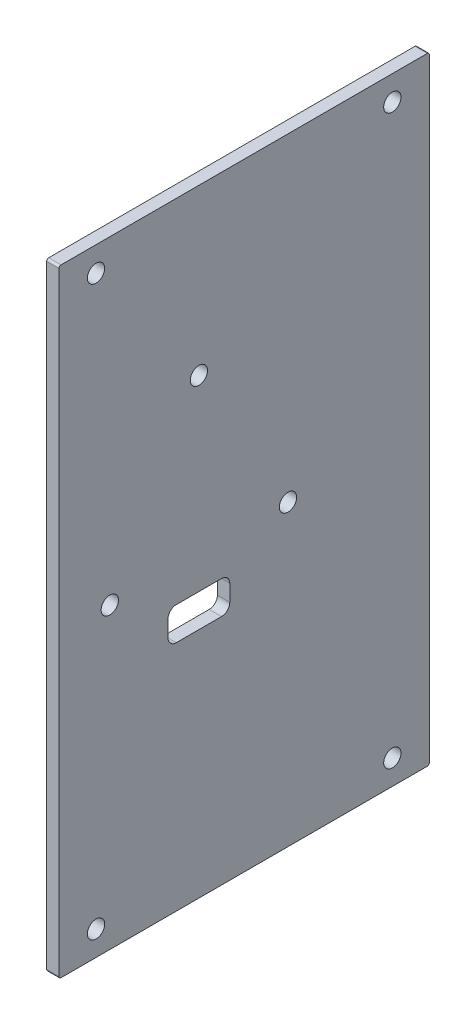
from build123d import *

# Parameters (mm, degrees)
SKETCH1_W           = 90
SKETCH1_H           = 150
SKETCH1_R           = 2.1
BOSS_EXTRUDE1_DEPTH = 3
FILLET1_R           = 0.5


with BuildPart() as part:
    # Sketch1 → Boss-Extrude1 (new body)
    with BuildSketch(Plane(origin=(0, 0, 0), x_dir=(0, 0, -1), z_dir=(1, 0, 0))):
        with Locations((45, -75)):
            Rectangle(SKETCH1_W, SKETCH1_H)
        with Locations((34, -40)):
            Circle(SKETCH1_R, mode=Mode.SUBTRACT)
        with Locations((55.650635095, -77.5)):
            Circle(SKETCH1_R, mode=Mode.SUBTRACT)
        with Locations((12.349364905, -77.5)):
            Circle(SKETCH1_R, mode=Mode.SUBTRACT)
        with Locations((9, -6)):
            Circle(SKETCH1_R, mode=Mode.SUBTRACT)
        with Locations((81, -6)):
            Circle(SKETCH1_R, mode=Mode.SUBTRACT)
        with Locations((81, -144)):
            Circle(SKETCH1_R, mode=Mode.SUBTRACT)
        with Locations((9, -144)):
            Circle(SKETCH1_R, mode=Mode.SUBTRACT)
        with BuildLine():
            Line((34, -85.5), (28.5, -85.5))
            ThreePointArc((28.5, -85.5), (27.085786438, -86.085786438), (26.5, -87.5))
            Line((26.5, -87.5), (26.5, -91.5))
            ThreePointArc((26.5, -91.5), (27.085786438, -92.914213562), (28.5, -93.5))
            Line((28.5, -93.5), (39.5, -93.5))
            ThreePointArc((39.5, -93.5), (40.914213562, -92.914213562), (41.5, -91.5))
            Line((41.5, -91.5), (41.5, -87.5))
            ThreePointArc((41.5, -87.5), (40.914213562, -86.085786438), (39.5, -85.5))
            Line((39.5, -85.5), (34, -85.5))
        make_face(mode=Mode.SUBTRACT)
    extrude(amount=BOSS_EXTRUDE1_DEPTH)

    # Fillet1
    fillet1_edges = [part.edges().sort_by_distance(p)[0] for p in [
        (1.5, -150, -90),
        (1.5, -150, 0),
        (1.5, 0, -90),
        (1.5, 0, 0),
    ]]
    fillet(fillet1_edges, radius=FILLET1_R)


solid = part.part
